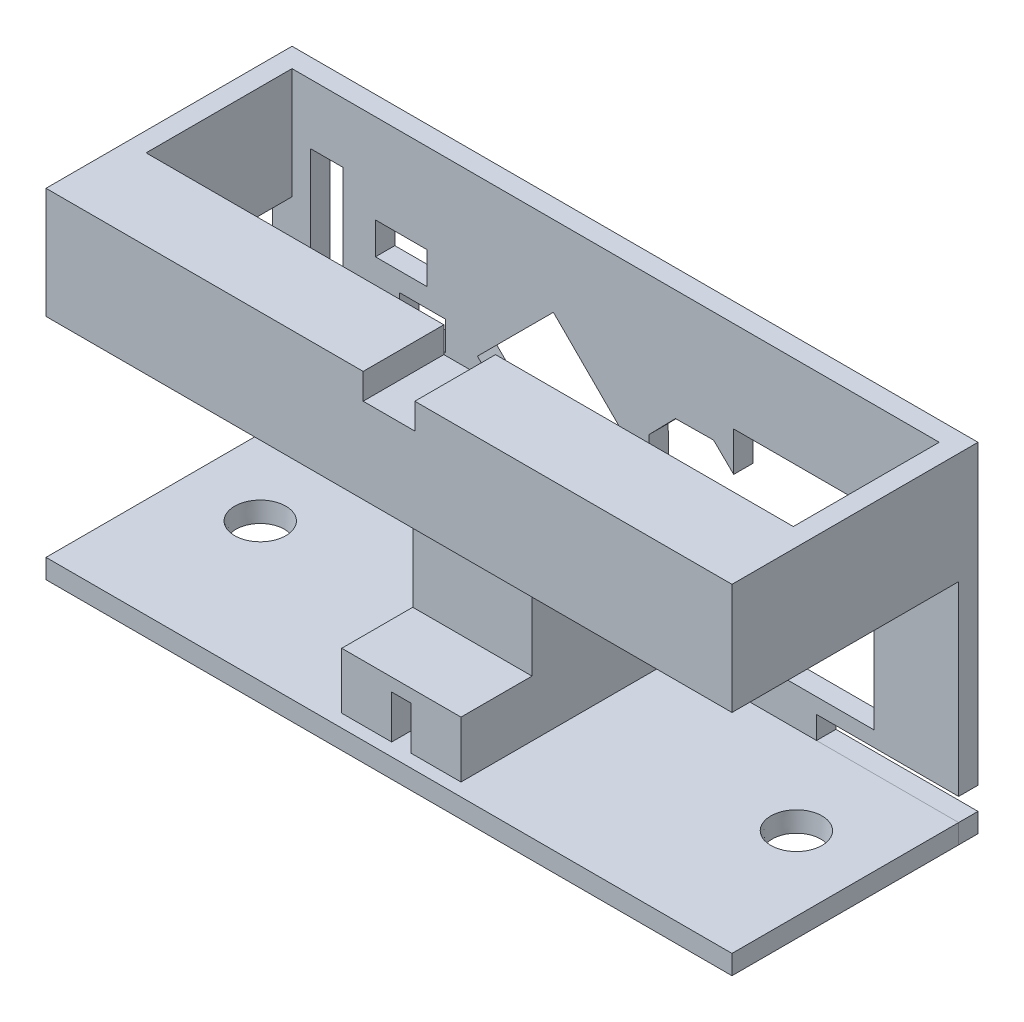
from build123d import *

# Parameters (mm, degrees)
SKETCH1_W                              = 53.116817528
SKETCH1_H                              = 26.25
FRONT_SIDE_MAIN_DEPTH                  = 1.5
RESET_HOLE_DEPTH                       = 3.25
SKETCH15_W                             = 3.966010581
SKETCH15_H                             = 2.112155191
SKETCH15_W_2                           = 3.557190409
SKETCH15_H_2                           = 2.236587576
SKETCH15_W_3                           = 3.981127105
SKETCH15_H_3                           = 2.476855865
COMPONENT_HOLES_DEPTH                  = 3.25
SKETCH16_W                             = 10.85
SKETCH16_H                             = 14.75
MICROPHONE_HOLE_DEPTH                  = 1.5
SKETCH24_W                             = 1.5
SKETCH24_H                             = 8.595542059
RIGHT_SIDE_TOP_DEPTH                   = 17.55
SKETCH20_W                             = 53.116817528
SKETCH20_H                             = 1.5
BOTTOM_BASE_DEPTH                      = 17.55
SKETCH26_W                             = 1.5
SKETCH26_H                             = 8.595542059
LEFT_SIDE_TOP_DEPTH                    = 17.55
SKETCH27_W                             = 6.25
SKETCH27_H                             = 8.595542059
BACK_BAR_TOP_DEPTH                     = 50.116817528
SERVO_SEPERATOR_BOTTOM_OUTLINE_W       = 9.232806166
SERVO_SEPERATOR_BOTTOM_OUTLINE_H       = 3.2
SERVO_SEPERATOR_BOTTOM_DEPTH           = 16.55
SKETCH28_W                             = 9.232806166
SKETCH28_H                             = 5.25
BACK_BATTERY_HOLDER_TOP_DEPTH          = 0.7
SKETCH34_W                             = 2.537171882
SKETCH34_H                             = 15
PROGRAMMING_HOLE_DEPTH                 = 3.25
SKETCH38_W                             = 9.232806166
SKETCH38_H                             = 5.5
BACK_BATTERY_HOLDER_BOTTOM_DEPTH       = 1.154457941
SKETCH40_R                             = 1.877628079
SERVO_ARM_HOLES_BOTTOM_DEPTH           = 1.5
SERVO_ARM_HOLES_BOTTOM_DRAFT           = 4
SERVO_ARM_HOLES_BOTTOM_PROFILE_2_DEPTH = 1.5
SERVO_ARM_HOLES_BOTTOM_PROFILE_2_DRAFT = 4
SKETCH44_W                             = 1.5
SKETCH44_H                             = 3.354457941
SNAP_HOLE_BOTTOM_DEPTH                 = 2
SKETCH46_W                             = 4
SKETCH46_H                             = 6.25
SNAP_CUT_TOP_DEPTH                     = 2
SKETCH47_W                             = 11
SKETCH47_H                             = 1.75
SOLAR_ARM_HOLES_FRONT_DEPTH            = 1.5
SKETCH49_W                             = 9.232806166
SKETCH49_H                             = 8
RAISED_SERVO_SEPERATOR_DEPTH           = 10


# Read off the part's stored shape, not the designer's step: Servo Seperator - Bottom
with BuildPart() as part:
    # Sketch1 → Front Side - Main (new body)
    with BuildSketch(Plane.XY):
        with Locations((26.558408764, 13.125)):
            Rectangle(SKETCH1_W, SKETCH1_H)
    extrude(amount=FRONT_SIDE_MAIN_DEPTH)

    # Reset Hole Sketch → Reset Hole (cut)
    with BuildSketch(Plane(origin=(0, 0, 3.25), x_dir=(-1, 0, 0), z_dir=(0, 0, -1))):
        Polygon((-31.190735744, 17.626168756), (-34.141748042, 17.658585925), (-36.251351249, 15.594827519), (-36.283768419, 12.643815222), (-34.220010013, 10.534212015), (-31.268997715, 10.501794845), (-29.159394508, 12.565553251), (-29.126977338, 15.516565548), align=None)
    extrude(amount=RESET_HOLE_DEPTH, mode=Mode.SUBTRACT)

    # Sketch15 → Component Holes (cut)
    with BuildSketch(Plane(origin=(0, 0, 3.25), x_dir=(-1, 0, 0), z_dir=(0, 0, -1))):
        Polygon((-21.737702993, 20.027277789), (-15.857179586, 14.146754382), (-21.737702993, 8.266230975), (-27.6182264, 14.146754382), align=None)
        with Locations((-11.649935563, 9.695513201)):
            Rectangle(SKETCH15_W, SKETCH15_H)
        with Locations((-11.599935563, 14.270513201)):
            Rectangle(SKETCH15_W_2, SKETCH15_H_2)
        with Locations((-9.949935563, 18.095513201)):
            Rectangle(SKETCH15_W_3, SKETCH15_H_3)
    extrude(amount=COMPONENT_HOLES_DEPTH, mode=Mode.SUBTRACT)

    # Sketch16 → Microphone Hole (cut)
    with BuildSketch(Plane(origin=(0, 0, 0), x_dir=(-1, 0, 0), z_dir=(0, 0, -1))):
        with Locations((-41.124935562, 11.81098353)):
            Rectangle(SKETCH16_W, SKETCH16_H)
    extrude(amount=-MICROPHONE_HOLE_DEPTH, mode=Mode.SUBTRACT)

    # Sketch24 → Right Side - Top (add)
    with BuildSketch(Plane.XY.offset(1.5)):
        with Locations((0.75, 21.952228971)):
            Rectangle(SKETCH24_W, SKETCH24_H)
    extrude(amount=RIGHT_SIDE_TOP_DEPTH)

    # Sketch26 → Left Side - Top (add)
    with BuildSketch(Plane.XY.offset(1.5)):
        with Locations((52.366817528, 21.952228971)):
            Rectangle(SKETCH26_W, SKETCH26_H)
    extrude(amount=LEFT_SIDE_TOP_DEPTH)

    # Sketch27 → Back Bar - Top (add)
    with BuildSketch(Plane(origin=(1.5, 0, 0), x_dir=(0, 0, -1), z_dir=(1, 0, 0))):
        with Locations((-15.925, 21.952228971)):
            Rectangle(SKETCH27_W, SKETCH27_H)
    extrude(amount=BACK_BAR_TOP_DEPTH)

    # Servo Seperator - Bottom outline → Servo Seperator - Bottom (add)
    with BuildSketch(Plane.XY.offset(1.5)):
        with Locations((26.516403083, 3.1)):
            Rectangle(SERVO_SEPERATOR_BOTTOM_OUTLINE_W, SERVO_SEPERATOR_BOTTOM_OUTLINE_H)
    extrude(amount=SERVO_SEPERATOR_BOTTOM_DEPTH)

    # Sketch28 → Back Battery Holder - Top (add)
    with BuildSketch(Plane.XZ.offset(-17.654457941)):
        with Locations((26.516403083, 15.425)):
            Rectangle(SKETCH28_W, SKETCH28_H)
    extrude(amount=BACK_BATTERY_HOLDER_TOP_DEPTH)

    # Sketch34 → Programming Hole (cut)
    with BuildSketch(Plane(origin=(0, 0, 0), x_dir=(-1, 0, 0), z_dir=(0, 0, -1))):
        with Locations((-4.194161079, 14.100049249)):
            Rectangle(SKETCH34_W, SKETCH34_H)
    extrude(amount=-PROGRAMMING_HOLE_DEPTH, mode=Mode.SUBTRACT)

    # Sketch38 → Back Battery Holder - Bottom (add)
    with BuildSketch(Plane(origin=(0, 4.7, 0), x_dir=(1, 0, 0), z_dir=(0, 1, 0))):
        with Locations((26.516403083, -15.3)):
            Rectangle(SKETCH38_W, SKETCH38_H)
    extrude(amount=BACK_BATTERY_HOLDER_BOTTOM_DEPTH)

    # Sketch44 → Snap Hole - Bottom (cut)
    with BuildSketch(Plane.XY.offset(18.05)):
        with Locations((26.516403083, 3.177228971)):
            Rectangle(SKETCH44_W, SKETCH44_H)
    extrude(amount=-SNAP_HOLE_BOTTOM_DEPTH, mode=Mode.SUBTRACT)

    # Sketch46 → Snap Cut - Top (cut)
    with BuildSketch(Plane(origin=(0, 26.25, 0), x_dir=(1, 0, 0), z_dir=(0, 1, 0))):
        with Locations((26.558408764, -15.925)):
            Rectangle(SKETCH46_W, SKETCH46_H)
    extrude(amount=-SNAP_CUT_TOP_DEPTH, mode=Mode.SUBTRACT)

    # Sketch47 → Solar Arm Holes - Front (cut)
    with BuildSketch(Plane(origin=(0, 0, 0), x_dir=(-1, 0, 0), z_dir=(0, 0, -1))):
        with Locations((-5.5, 2.375)):
            Rectangle(SKETCH47_W, SKETCH47_H)
        with Locations((-47.616817528, 2.375)):
            Rectangle(SKETCH47_W, SKETCH47_H)
    extrude(amount=-SOLAR_ARM_HOLES_FRONT_DEPTH, mode=Mode.SUBTRACT)

    # Sketch49 → Raised Servo Seperator (add)
    with BuildSketch(Plane(origin=(0, 4.7, 0), x_dir=(1, 0, 0), z_dir=(0, 1, 0))):
        with Locations((26.516403083, -8.55)):
            Rectangle(SKETCH49_W, SKETCH49_H)
    extrude(amount=RAISED_SERVO_SEPERATOR_DEPTH)


with BuildPart() as body_2:
    # Sketch20 → Bottom Base (new body)
    with BuildSketch(Plane.XY.offset(1.5)):
        with Locations((26.558408764, 0.75)):
            Rectangle(SKETCH20_W, SKETCH20_H)
    extrude(amount=BOTTOM_BASE_DEPTH)


with BuildPart() as servo_arm_holes_bottom_tool:
    # Sketch40 → Servo arm Holes - Bottom (with draft: the straight prism first)
    with BuildSketch(Plane.XZ):
        with Locations((5.851424663, 8.311788641)):
            Circle(SKETCH40_R)
    extrude(amount=-SERVO_ARM_HOLES_BOTTOM_DEPTH)
    # Servo arm Holes - Bottom: the draft: its side faces are tilted about the plane it starts from
    servo_arm_holes_bottom_sides = [servo_arm_holes_bottom_tool.faces().sort_by_distance(p)[0] for p in [
        (3.973796583, 0.75, 8.311788641),
    ]]
    draft(servo_arm_holes_bottom_sides, Plane.XZ, SERVO_ARM_HOLES_BOTTOM_DRAFT)


with BuildPart() as body_2_1:
    add(body_2.part)

    # Servo arm Holes - Bottom: cut by servo_arm_holes_bottom_tool
    add(servo_arm_holes_bottom_tool.part, mode=Mode.SUBTRACT)


with BuildPart() as servo_arm_holes_bottom_profile_2_tool:
    # Sketch40 → Servo arm Holes - Bottom profile 2 (with draft: the straight prism first)
    with BuildSketch(Plane.XZ):
        with Locations((47.381795968, 8.325039035)):
            Circle(SKETCH40_R)
    extrude(amount=-SERVO_ARM_HOLES_BOTTOM_PROFILE_2_DEPTH)
    # Servo arm Holes - Bottom profile 2: the draft: its side faces are tilted about the plane it starts from
    servo_arm_holes_bottom_profile_2_sides = [servo_arm_holes_bottom_profile_2_tool.faces().sort_by_distance(p)[0] for p in [
        (45.504167889, 0.75, 8.325039035),
    ]]
    draft(servo_arm_holes_bottom_profile_2_sides, Plane.XZ, SERVO_ARM_HOLES_BOTTOM_PROFILE_2_DRAFT)


with BuildPart() as body_2_2:
    add(body_2_1.part)

    # Servo arm Holes - Bottom profile 2: cut by servo_arm_holes_bottom_profile_2_tool
    add(servo_arm_holes_bottom_profile_2_tool.part, mode=Mode.SUBTRACT)


solid = Compound([part.part, body_2_2.part])
